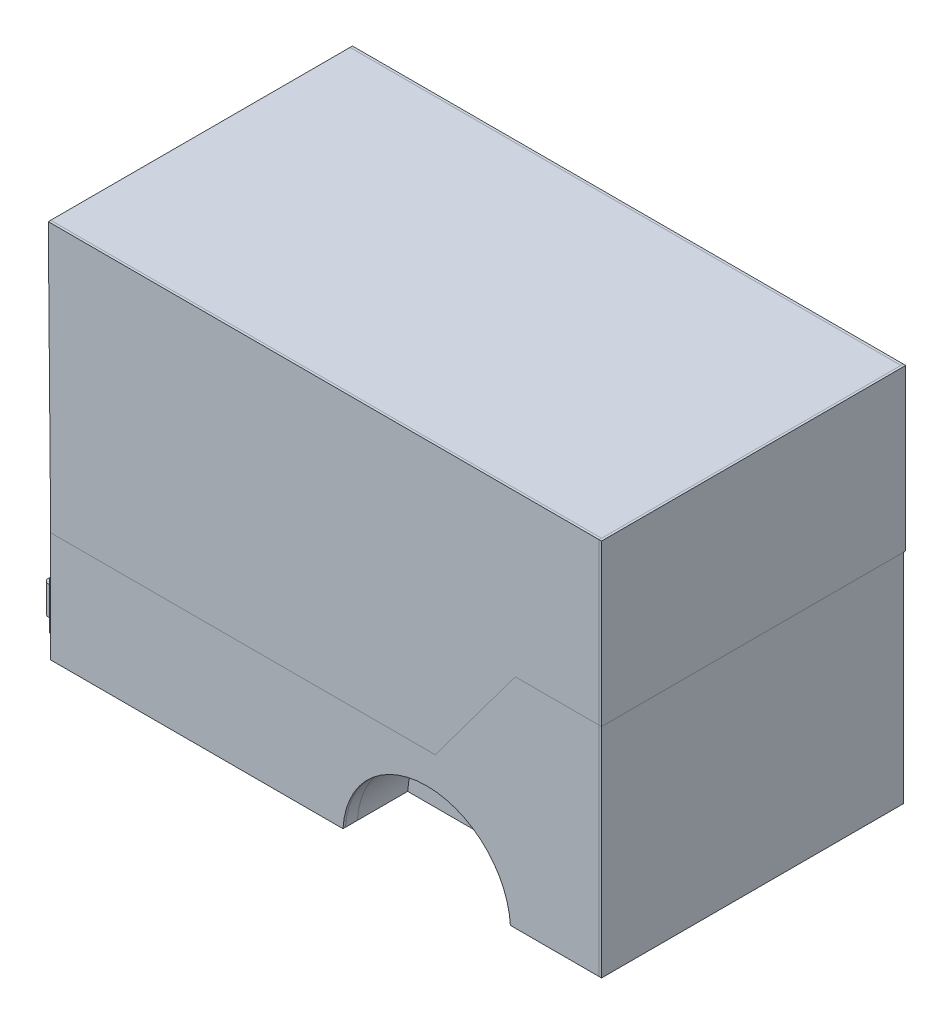
from build123d import *

# Parameters (mm, degrees)
SKETCH_1_W                = 229
SKETCH_1_H                = 125
EXTRUDE_1_DEPTH           = 88
SKETCH_4_W                = 125
SKETCH_4_H                = 88
SKETCH_4_W_2              = 123
SKETCH_4_H_2              = 86
CUT_EXTRUDE_3_DEPTH       = 1
SKETCH_5_W                = 125
SKETCH_5_H                = 88
EXTRUDE_2_DEPTH           = 1
SKETCH_11_W               = 5
SKETCH_11_H               = 20
EXTRUDE_3_DEPTH           = 2
SKETCH_12_R               = 2
EXTRUDE_4_DEPTH           = 12
SKETCH_13_R               = 35
CUT_EXTRUDE_7_DEPTH       = 26
CUT_EXTRUDE_START         = -26
SKETCH_14_R               = 35
CUT_EXTRUDE_8_DEPTH       = 26
SKETCH_16_W               = 229
SKETCH_16_H               = 125
EXTRUDE_6_DEPTH           = 70
SHELL_START               = -980.231317195
SHELL_1_OUTLINE_W         = 148
SHELL_1_OUTLINE_H         = 115
SHELL_1_DEPTH             = 113.617262665
SHELL_START_2             = -787.84857986
SHELL_1_2_OUTLINE_W       = 148
SHELL_1_2_OUTLINE_H       = 115
SHELL_1_2_DEPTH           = 31.617262665
SHELL_1_3_OUTLINE_W       = 3
SHELL_1_3_OUTLINE_H       = 63
SHELL_1_3_DEPTH           = 224
SHELL_START_3             = -981.231317195
SHELL_1_4_DEPTH           = 1
SHELL_START_4             = 7.020467364
SHELL_1_5_DEPTH           = 115
SHELL_START_5             = 33.020467364
SHELL_1_6_DEPTH           = 63
CUT_EXTRUDE_START_2       = -70
CUT_EXTRUDE_9_DEPTH       = 70
SKETCH_20_W               = 125
SKETCH_20_H               = 158
SKETCH_20_W_2             = 115
SKETCH_20_H_2             = 148
EXTRUDE_7_DEPTH           = 1
CUT_EXTRUDE_START_3       = -5
CUT_EXTRUDE_14_DEPTH      = 5
EXTRUDE_8_DEPTH           = 5
SKETCH_26_W               = 230
SKETCH_26_H               = 125
CUT_EXTRUDE_15_DEPTH      = 5
SKETCH_27_W               = 230
SKETCH_27_H               = 125
EXTRUDE_9_DEPTH           = 5
SKETCH_28_W               = 5
SKETCH_28_H               = 115
EXTRUDE_10_DEPTH          = 148
EXTRUDE_11_DEPTH          = 1
EXTRUDE_12_DEPTH          = 1
SKETCH_32_W               = 127
SKETCH_32_H               = 67.090624259
EXTRUDE_13_DEPTH          = 1
SKETCH_33_W               = 126
SKETCH_33_H               = 90.909375741
EXTRUDE_14_DEPTH          = 1
CUT_EXTRUDE_16_DEPTH      = 40
CUT_EXTRUDE_16_DEPTH_BACK = 10
SKETCH_34_W               = 225
SKETCH_34_H               = 5
SKETCH_35_W               = 220
SKETCH_35_H               = 153
EXTRUDE_16_DEPTH          = 5
SKETCH_36_W               = 5
SKETCH_36_H               = 153
EXTRUDE_17_DEPTH          = 5
CUT_EXTRUDE_17_DEPTH      = 5
SKETCH_39_W               = 115
SKETCH_39_H               = 5
CUT_EXTRUDE_18_DEPTH      = 5
SKETCH_40_W               = 5
SKETCH_40_H               = 120
EXTRUDE_19_DEPTH          = 153
SKETCH_45_W               = 78.76547467
SKETCH_45_H               = 26
EXTRUDE_21_DEPTH          = 33
CUT_EXTRUDE_20_DEPTH      = 21
SKETCH_48_R               = 34.912032086
CUT_EXTRUDE_21_DEPTH      = 21
SKETCH_51_W               = 120
SKETCH_51_H               = 50
EXTRUDE_22_DEPTH          = 35
SKETCH_53_W               = 78.76547467
SKETCH_53_H               = 33
SKETCH_53_R               = 0.014289014
CUT_EXTRUDE_22_DEPTH      = 26
SKETCH_55_W               = 15
SKETCH_55_H               = 25
EXTRUDE_23_DEPTH          = 10
FILLET_1_R                = 5
SKETCH_56_W               = 90
SKETCH_56_H               = 57
EXTRUDE_24_DEPTH          = 7
SKETCH_57_W               = 90
SKETCH_57_H               = 7
EXTRUDE_25_DEPTH          = 17
FILLET_2_R                = 5
FILLET_3_R                = 5
FILLET_4_R                = 5
SKETCH_58_W               = 120
SKETCH_58_H               = 26
EXTRUDE_26_DEPTH          = 47
SKETCH_59_W               = 78.76547467
SKETCH_59_H               = 33
CUT_EXTRUDE_24_DEPTH      = 26
SKETCH_60_W               = 120
SKETCH_60_H               = 47
EXTRUDE_27_DEPTH          = 5
SKETCH_61_W               = 30
SKETCH_61_H               = 31
EXTRUDE_28_DEPTH          = 4
SKETCH_62_R               = 9
EXTRUDE_29_DEPTH          = 1
SKETCH_63_W               = 13
SKETCH_63_H               = 4
CUT_EXTRUDE_25_DEPTH      = 1
SKETCH_64_R               = 2.5
EXTRUDE_30_DEPTH          = 1
SKETCH_65_W               = 30
SKETCH_65_H               = 45
EXTRUDE_31_DEPTH          = 31
FILLET_5_R                = 30
SKETCH_67_W               = 30
SKETCH_67_H               = 31
EXTRUDE_32_DEPTH          = 10
CUT_EXTRUDE_27_DEPTH      = 13
CUT_EXTRUDE_27_DRAFT      = -12
SKETCH_69_R               = 1.5
EXTRUDE_33_DEPTH          = 1
SKETCH_71_R               = 1.5
SKETCH_72_W               = 88
SKETCH_72_H               = 55
EXTRUDE_34_DEPTH          = 31
CUT_EXTRUDE_28_DEPTH      = 55
SKETCH_75_W               = 1
SKETCH_75_H               = 31
CUT_EXTRUDE_29_DEPTH      = 55
CUT_EXTRUDE_30_DEPTH      = 55
SKETCH_77_W               = 1
SKETCH_77_H               = 47
CUT_EXTRUDE_32_DEPTH      = 31
SKETCH_78_R               = 2.5
EXTRUDE_35_DEPTH          = 1
SKETCH_79_W               = 9
SKETCH_79_H               = 3.729617428
EXTRUDE_36_DEPTH          = 1
EXTRUDE_36_2_DEPTH        = 1
SKETCH_80_R               = 13.5
SKETCH_80_R_2             = 10.5
EXTRUDE_37_DEPTH          = 1
SKETCH_81_R               = 10.5
EXTRUDE_38_DEPTH          = 0.1
SKETCH_82_W               = 45
SKETCH_82_H               = 148
EXTRUDE_39_DEPTH          = 31
SKETCH_83_W               = 45
SKETCH_83_H               = 1
CUT_EXTRUDE_33_DEPTH      = 29
SKETCH_85_R               = 1.5
CUT_EXTRUDE_34_DEPTH      = 100
CUT_EXTRUDE_35_DEPTH      = 25
SKETCH_87_W               = 64
SKETCH_87_H               = 36
EXTRUDE_40_DEPTH          = 1
SKETCH_88_W               = 70
SKETCH_88_H               = 42
SKETCH_88_W_2             = 64
SKETCH_88_H_2             = 36
EXTRUDE_41_DEPTH          = 2
SKETCH_89_W               = 53
SKETCH_89_H               = 123
EXTRUDE_42_DEPTH          = 31
SKETCH_91_W               = 1
SKETCH_91_H               = 120
SKETCH_91_H_2             = 3
CUT_EXTRUDE_37_DEPTH      = 2
SKETCH_92_W               = 10
SKETCH_92_H               = 10
EXTRUDE_43_DEPTH          = 50
SKETCH_93_W               = 45.352646597
SKETCH_93_H               = 54.126667381
EXTRUDE_44_DEPTH          = 5


with BuildPart() as part:
    # 스케치1 → 보스-돌출1 (new body)
    with BuildSketch(Plane(origin=(0, 0, 0), x_dir=(1, 0, 0), z_dir=(0, 1, 0))):
        with Locations((-871.731317195, -64.520467364)):
            Rectangle(SKETCH_1_W, SKETCH_1_H)
    extrude(amount=EXTRUDE_1_DEPTH)

    # 스케치4 → 컷-돌출3 (cut)
    # profile 1 of 2: a face of its own
    with BuildSketch(Plane.ZY.offset(986.231317195)):
        with Locations((64.520467364, 44)):
            Rectangle(SKETCH_4_W, SKETCH_4_H)
        with Locations((64.520467364, 44)):
            Rectangle(SKETCH_4_W_2, SKETCH_4_H_2, mode=Mode.SUBTRACT)
    # profile 2 of 2: a face of its own
    with BuildSketch(Plane.ZY.offset(986.231317195)):
        with BuildLine():
            Line((6.020467364, 84), (6.020467364, 67.306026885))
            ThreePointArc((6.020467364, 67.306026885), (6.552613646, 56.95178287), (8.143444971, 46.70664722))
            Line((8.143444971, 46.70664722), (8.939528918, 42.885444272))
            ThreePointArc((8.939528918, 42.885444272), (10.498858633, 32.843182595), (11.020467364, 22.693973115))
            Line((11.020467364, 22.693973115), (11.020467364, 2))
            Line((11.020467364, 2), (118.020467364, 2))
            Line((118.020467364, 2), (118.020467364, 22.693973115))
            ThreePointArc((118.020467364, 22.693973115), (118.542076095, 32.843182595), (120.10140581, 42.885444272))
            Line((120.10140581, 42.885444272), (120.897489758, 46.70664722))
            ThreePointArc((120.897489758, 46.70664722), (122.488321083, 56.95178287), (123.020467364, 67.306026885))
            Line((123.020467364, 67.306026885), (123.020467364, 84))
            Line((123.020467364, 84), (6.020467364, 84))
        make_face()
        with BuildLine():
            Line((12.020467364, 22.693973115), (12.020467364, 3))
            Line((12.020467364, 3), (117.020467364, 3))
            Line((117.020467364, 3), (117.020467364, 22.693973115))
            ThreePointArc((117.020467364, 22.693973115), (117.547344871, 32.945699863), (119.122425391, 43.089398526))
            Line((119.122425391, 43.089398526), (119.918509338, 46.910601474))
            ThreePointArc((119.918509338, 46.910601474), (121.493589858, 57.054300137), (122.020467364, 67.306026885))
            Line((122.020467364, 67.306026885), (122.020467364, 83))
            Line((122.020467364, 83), (7.020467364, 83))
            Line((7.020467364, 83), (7.020467364, 67.306026885))
            ThreePointArc((7.020467364, 67.306026885), (7.547344871, 57.054300137), (9.122425391, 46.910601474))
            Line((9.122425391, 46.910601474), (9.918509338, 43.089398526))
            ThreePointArc((9.918509338, 43.089398526), (11.493589858, 32.945699863), (12.020467364, 22.693973115))
        make_face(mode=Mode.SUBTRACT)
    extrude(amount=-CUT_EXTRUDE_3_DEPTH, mode=Mode.SUBTRACT)

    # 스케치5 → 보스-돌출2 (add)
    with BuildSketch(Plane(origin=(-757.231317195, 0, 0), x_dir=(0, 0, -1), z_dir=(1, 0, 0))):
        with Locations((-64.520467364, 44)):
            Rectangle(SKETCH_5_W, SKETCH_5_H)
    extrude(amount=EXTRUDE_2_DEPTH)

    # 스케치13 → 컷-돌출7 (cut)
    with BuildSketch(Plane.XY.offset(127.020467364)):
        with Locations((-827.231317195, -2)):
            Circle(SKETCH_13_R)
    extrude(amount=-CUT_EXTRUDE_7_DEPTH, mode=Mode.SUBTRACT)

    # 스케치14 → 컷-돌출8 (cut)
    with BuildSketch(Plane(origin=(0, 0, 2.020467364), x_dir=(-1, 0, 0), z_dir=(0, 0, -1)).offset(CUT_EXTRUDE_START)):
        with Locations((827.231317195, -2)):
            Circle(SKETCH_14_R)
    extrude(amount=CUT_EXTRUDE_8_DEPTH, mode=Mode.SUBTRACT)

    # 스케치16 → 보스-돌출6 (add)
    with BuildSketch(Plane(origin=(0, 88, 0), x_dir=(1, 0, 0), z_dir=(0, 1, 0))):
        with Locations((-870.731317195, -64.520467364)):
            Rectangle(SKETCH_16_W, SKETCH_16_H)
    extrude(amount=EXTRUDE_6_DEPTH)

    # 쉘1: read off the stored shape, not the designer's step
    # 쉘1 outline → 쉘1 (cut)
    with BuildSketch(Plane.YZ.offset(SHELL_START)):
        with Locations((79, 64.520467364)):
            Rectangle(SHELL_1_OUTLINE_W, SHELL_1_OUTLINE_H)
    extrude(amount=SHELL_1_DEPTH, mode=Mode.SUBTRACT)

    # Shell 1 2 outline → Shell 1 2 (cut)
    with BuildSketch(Plane.YZ.offset(SHELL_START_2)):
        with Locations((79, 64.520467364)):
            Rectangle(SHELL_1_2_OUTLINE_W, SHELL_1_2_OUTLINE_H)
    extrude(amount=SHELL_1_2_DEPTH, mode=Mode.SUBTRACT)

    # Shell 1 3 outline → Shell 1 3 (cut)
    with BuildSketch(Plane.YZ.offset(SHELL_START)):
        with Locations((6.5, 64.520467364)):
            Rectangle(SHELL_1_3_OUTLINE_W, SHELL_1_3_OUTLINE_H)
    extrude(amount=SHELL_1_3_DEPTH, mode=Mode.SUBTRACT)

    # Shell 1 4 outline → Shell 1 4 (cut)
    with BuildSketch(Plane.YZ.offset(SHELL_START_3)):
        with BuildLine():
            Line((8, 96.020467364), (8, 33.020467364))
            Line((8, 33.020467364), (8, 17.020467364))
            Line((8, 17.020467364), (22.693973115, 17.020467364))
            ThreePointArc((22.693973115, 17.020467364), (33.4582862, 16.467245983), (44.109169797, 14.813411437))
            Line((44.109169797, 14.813411437), (47.930372745, 14.017327489))
            ThreePointArc((47.930372745, 14.017327489), (57.566886475, 12.521000995), (67.306026885, 12.020467364))
            Line((67.306026885, 12.020467364), (78, 12.020467364))
            Line((78, 12.020467364), (78, 117.020467364))
            Line((78, 117.020467364), (67.306026885, 117.020467364))
            ThreePointArc((67.306026885, 117.020467364), (57.566886475, 116.519933734), (47.930372745, 115.023607239))
            Line((47.930372745, 115.023607239), (44.109169797, 114.227523292))
            ThreePointArc((44.109169797, 114.227523292), (33.4582862, 112.573688746), (22.693973115, 112.020467364))
            Line((22.693973115, 112.020467364), (8, 112.020467364))
            Line((8, 112.020467364), (8, 96.020467364))
        make_face()
    extrude(amount=SHELL_1_4_DEPTH, mode=Mode.SUBTRACT)

    # Shell 1 5 outline → Shell 1 5 (cut)
    with BuildSketch(Plane.XY.offset(SHELL_START_4)):
        with BuildLine():
            Line((-787.84857986, 5), (-787.84857986, 153))
            Line((-787.84857986, 153), (-866.61405453, 153))
            Line((-866.61405453, 153), (-866.61405453, 5))
            ThreePointArc((-866.61405453, 5), (-827.231317195, 38), (-787.84857986, 5))
        make_face()
    extrude(amount=SHELL_1_5_DEPTH, mode=Mode.SUBTRACT)

    # Shell 1 6 outline → Shell 1 6 (cut)
    with BuildSketch(Plane.XY.offset(SHELL_START_5)):
        with BuildLine():
            Line((-865.961150657, 8), (-788.501483733, 8))
            ThreePointArc((-788.501483733, 8), (-827.231317195, 38), (-865.961150657, 8))
        make_face()
    extrude(amount=SHELL_1_6_DEPTH, mode=Mode.SUBTRACT)

    # 스케치18 → 컷-돌출9 (cut)
    with BuildSketch(Plane(origin=(-981.231317195, 0, 0), x_dir=(0, 0, -1), z_dir=(1, 0, 0)).offset(CUT_EXTRUDE_START_2)):
        with BuildLine():
            Line((-17.020467364, 8), (-17.020467364, 22.693973115))
            ThreePointArc((-17.020467364, 22.693973115), (-16.467245983, 33.4582862), (-14.813411437, 44.109169797))
            Line((-14.813411437, 44.109169797), (-14.017327489, 47.930372745))
            ThreePointArc((-14.017327489, 47.930372745), (-12.521000995, 57.566886475), (-12.020467364, 67.306026885))
            Line((-12.020467364, 67.306026885), (-12.020467364, 78))
            Line((-12.020467364, 78), (-117.020467364, 78))
            Line((-117.020467364, 78), (-117.020467364, 67.306026885))
            ThreePointArc((-117.020467364, 67.306026885), (-116.519933734, 57.566886475), (-115.023607239, 47.930372745))
            Line((-115.023607239, 47.930372745), (-114.227523292, 44.109169797))
            ThreePointArc((-114.227523292, 44.109169797), (-112.573688746, 33.4582862), (-112.020467364, 22.693973115))
            Line((-112.020467364, 22.693973115), (-112.020467364, 8))
            Line((-112.020467364, 8), (-17.020467364, 8))
        make_face()
    extrude(amount=CUT_EXTRUDE_9_DEPTH, mode=Mode.SUBTRACT)

    # 스케치20 → 보스-돌출7 (add)
    with BuildSketch(Plane(origin=(-756.231317195, 0, 0), x_dir=(0, 0, -1), z_dir=(1, 0, 0))):
        with Locations((-64.520467364, 79)):
            Rectangle(SKETCH_20_W, SKETCH_20_H)
        with Locations((-64.520467364, 79)):
            Rectangle(SKETCH_20_W_2, SKETCH_20_H_2, mode=Mode.SUBTRACT)
    extrude(amount=EXTRUDE_7_DEPTH)

    # 스케치24 → 컷-돌출14 (cut)
    with BuildSketch(Plane.XY.offset(127.020467364).offset(CUT_EXTRUDE_START_3)):
        with BuildLine():
            Line((-755.231317195, 153), (-980.231317195, 153))
            Line((-980.231317195, 153), (-980.231317195, 5))
            Line((-980.231317195, 5), (-866.61405453, 5))
            ThreePointArc((-866.61405453, 5), (-827.231317195, 38), (-787.84857986, 5))
            Line((-787.84857986, 5), (-755.231317195, 5))
            Line((-755.231317195, 5), (-755.231317195, 153))
        make_face()
    extrude(amount=CUT_EXTRUDE_14_DEPTH, mode=Mode.SUBTRACT)

    # 스케치26 → 컷-돌출15 (cut)
    with BuildSketch(Plane(origin=(0, 158, 0), x_dir=(1, 0, 0), z_dir=(0, 1, 0))):
        with Locations((-870.231317195, -64.520467364)):
            Rectangle(SKETCH_26_W, SKETCH_26_H)
    extrude(amount=-CUT_EXTRUDE_15_DEPTH, mode=Mode.SUBTRACT)

    # 스케치34 → 컷-돌출16 (cut, two sides: drawn at the far end of the back side and taken through both)
    with BuildSketch(Plane(origin=(0, 5, 0), x_dir=(1, 0, 0), z_dir=(0, 1, 0)).offset(-CUT_EXTRUDE_16_DEPTH_BACK)):
        with Locations((-867.731317195, -124.520467364)):
            Rectangle(SKETCH_34_W, SKETCH_34_H)
    extrude(amount=CUT_EXTRUDE_16_DEPTH + CUT_EXTRUDE_16_DEPTH_BACK, mode=Mode.SUBTRACT)

    # 스케치39 → 컷-돌출18 (cut)
    with BuildSketch(Plane(origin=(-755.231317195, 0, 0), x_dir=(0, 0, -1), z_dir=(1, 0, 0))):
        with Locations((-64.520467364, 2.5)):
            Rectangle(SKETCH_39_W, SKETCH_39_H)
    extrude(amount=-CUT_EXTRUDE_18_DEPTH, mode=Mode.SUBTRACT)

    # 스케치45 → 보스-돌출21 (add)
    with BuildSketch(Plane(origin=(0, 5, 0), x_dir=(1, 0, 0), z_dir=(0, 1, 0))):
        with Locations((-827.231317195, -20.020467364)):
            Rectangle(SKETCH_45_W, SKETCH_45_H)
        with Locations((-827.231317195, -109.020467364)):
            Rectangle(SKETCH_45_W, SKETCH_45_H)
    extrude(amount=EXTRUDE_21_DEPTH)

    # 스케치47 → 컷-돌출20 (cut)
    with BuildSketch(Plane.XY.offset(122.020467364)):
        with BuildLine():
            Line((-862.174127614, 0), (-792.288506775, 0))
            ThreePointArc((-792.288506775, 0), (-827.231317195, 33), (-862.174127614, 0))
        make_face()
    extrude(amount=-CUT_EXTRUDE_20_DEPTH, mode=Mode.SUBTRACT)

    # 스케치48 → 컷-돌출21 (cut)
    with BuildSketch(Plane(origin=(0, 0, 7.020467364), x_dir=(-1, 0, 0), z_dir=(0, 0, -1))):
        with Locations((827.252311569, -1.914574066)):
            Circle(SKETCH_48_R)
    extrude(amount=-CUT_EXTRUDE_21_DEPTH, mode=Mode.SUBTRACT)


with BuildPart() as body_2:
    # 스케치11 → 보스-돌출3 (new body)
    with BuildSketch(Plane.ZY.offset(986.231317195)):
        with Locations((122.020467364, 16)):
            Rectangle(SKETCH_11_W, SKETCH_11_H)
    extrude(amount=EXTRUDE_3_DEPTH)

    # 스케치12 → 보스-돌출4 (add)
    with BuildSketch(Plane(origin=(0, 23, 0), x_dir=(1, 0, 0), z_dir=(0, 1, 0))):
        with Locations((-989.231317195, -122.020467364)):
            Circle(SKETCH_12_R)
    extrude(amount=-EXTRUDE_4_DEPTH)


with BuildPart() as body_3:
    # 대칭 복사1: mirrored copy
    add(body_2.part.mirror(Plane.XY.offset(64.520467364)))


with BuildPart() as body_4:
    # 스케치25 → 보스-돌출8 (new body)
    with BuildSketch(Plane.XY.offset(127.020467364)):
        with BuildLine():
            Line((-980.231317195, 153), (-755.231317195, 153))
            Line((-755.231317195, 153), (-755.231317195, 5))
            Line((-755.231317195, 5), (-787.616277727, 5))
            ThreePointArc((-787.616277727, 5), (-826.999015062, 38), (-866.381752397, 5))
            Line((-866.381752397, 5), (-980.231317195, 5))
            Line((-980.231317195, 5), (-980.231317195, 153))
        make_face()
    extrude(amount=-EXTRUDE_8_DEPTH)


with BuildPart() as body_5:
    # 스케치27 → 보스-돌출9 (new body)
    with BuildSketch(Plane(origin=(0, 153, 0), x_dir=(1, 0, 0), z_dir=(0, 1, 0))):
        with Locations((-870.231317195, -64.520467364)):
            Rectangle(SKETCH_27_W, SKETCH_27_H)
    extrude(amount=EXTRUDE_9_DEPTH)


with BuildPart() as body_6:
    # 스케치28 → 보스-돌출10 (new body)
    with BuildSketch(Plane(origin=(0, 5, 0), x_dir=(1, 0, 0), z_dir=(0, 1, 0))):
        with Locations((-757.731317195, -64.520467364)):
            Rectangle(SKETCH_28_W, SKETCH_28_H)
    extrude(amount=EXTRUDE_10_DEPTH)


with BuildPart() as body_7:
    # 스케치29 → 보스-돌출11 (new body)
    with BuildSketch(Plane(origin=(0, 0, 2.020467364), x_dir=(-1, 0, 0), z_dir=(0, 0, -1))):
        with BuildLine():
            Line((984.231317195, 0), (984.231317195, 46))
            Line((984.231317195, 46), (823.655113572, 46))
            Line((823.655113572, 46), (790.231317195, 90.909375741))
            Line((790.231317195, 90.909375741), (755.231317195, 90.909375741))
            Line((755.231317195, 90.909375741), (755.231317195, 0))
            Line((755.231317195, 0), (792.288506775, 0))
            ThreePointArc((792.288506775, 0), (827.231317195, 33), (862.174127614, 0))
            Line((862.174127614, 0), (984.231317195, 0))
        make_face()
    extrude(amount=EXTRUDE_11_DEPTH)


with BuildPart() as body_8:
    # 스케치30 → 보스-돌출12 (new body)
    with BuildSketch(Plane(origin=(0, 0, 2.020467364), x_dir=(-1, 0, 0), z_dir=(0, 0, -1))):
        Polygon((755.231317195, 90.909375741), (755.231317195, 158), (985.231317195, 158), (984.231317195, 46), (823.655113572, 46), (790.231317195, 90.909375741), align=None)
    extrude(amount=EXTRUDE_12_DEPTH)


with BuildPart() as body_8_2:
    # 대칭 복사3: mirrored copy
    add(body_8.part.mirror(Plane.XY.offset(64.520467364)))


with BuildPart() as body_9:
    # Mirror 3 2: mirrored copy
    add(body_7.part.mirror(Plane.XY.offset(64.520467364)))


with BuildPart() as body_10:
    # 스케치32 → 보스-돌출13 (new body)
    with BuildSketch(Plane(origin=(-755.231317195, 0, 0), x_dir=(0, 0, -1), z_dir=(1, 0, 0))):
        with Locations((-64.520467364, 124.454687871)):
            Rectangle(SKETCH_32_W, SKETCH_32_H)
    extrude(amount=EXTRUDE_13_DEPTH)


with BuildPart() as body_11:
    # 스케치33 → 보스-돌출14 (new body)
    with BuildSketch(Plane(origin=(-755.231317195, 0, 0), x_dir=(0, 0, -1), z_dir=(1, 0, 0))):
        with Locations((-65.020467364, 45.454687871)):
            Rectangle(SKETCH_33_W, SKETCH_33_H)
    extrude(amount=EXTRUDE_14_DEPTH)


with BuildPart() as body_12:
    # 대칭 복사4: mirrored copy
    add(body_2.part.mirror(Plane.XY.offset(64.520467364)))


with BuildPart() as body_12_2:
    # 스케치35 → 보스-돌출16 (new body)
    with BuildSketch(Plane.XY.offset(122.020467364)):
        with Locations((-870.231317195, 76.5)):
            Rectangle(SKETCH_35_W, SKETCH_35_H)
    extrude(amount=EXTRUDE_16_DEPTH)

    # 스케치36 → 보스-돌출17 (add)
    with BuildSketch(Plane(origin=(-760.231317195, 0, 0), x_dir=(0, 0, -1), z_dir=(1, 0, 0))):
        with Locations((-124.520467364, 76.5)):
            Rectangle(SKETCH_36_W, SKETCH_36_H)
    extrude(amount=EXTRUDE_17_DEPTH)

    # 스케치37 → 컷-돌출17 (cut)
    with BuildSketch(Plane.XY.offset(127.020467364)):
        with BuildLine():
            Line((-862.174127614, 0), (-792.288506775, 0))
            ThreePointArc((-792.288506775, 0), (-827.231317195, 33), (-862.174127614, 0))
        make_face()
    extrude(amount=-CUT_EXTRUDE_17_DEPTH, mode=Mode.SUBTRACT)


with BuildPart() as body_12_3:
    # 스케치40 → 보스-돌출19 (new body)
    with BuildSketch(Plane.XZ):
        with Locations((-757.731317195, 67.020467364)):
            Rectangle(SKETCH_40_W, SKETCH_40_H)
    extrude(amount=-EXTRUDE_19_DEPTH)


with BuildPart() as body_13:
    # 스케치51 → 보스-돌출22 (new body)
    with BuildSketch(Plane(origin=(0, 5, 0), x_dir=(1, 0, 0), z_dir=(0, 1, 0))):
        with Locations((-820.231317195, -97.020467364)):
            Rectangle(SKETCH_51_W, SKETCH_51_H)
    extrude(amount=EXTRUDE_22_DEPTH)

    # 스케치53 → 컷-돌출22 (cut)
    with BuildSketch(Plane.XY.offset(122.020467364)):
        with Locations((-827.231317195, 21.5)):
            Rectangle(SKETCH_53_W, SKETCH_53_H)
        with Locations((-815.482459934, 30.984311243)):
            Circle(SKETCH_53_R, mode=Mode.SUBTRACT)
    extrude(amount=-CUT_EXTRUDE_22_DEPTH, mode=Mode.SUBTRACT)


with BuildPart() as body_14:
    # 스케치55 → 보스-돌출23 (new body)
    with BuildSketch(Plane(origin=(0, 40, 0), x_dir=(1, 0, 0), z_dir=(0, 1, 0))):
        with Locations((-776.731317195, -97.020467364)):
            Rectangle(SKETCH_55_W, SKETCH_55_H)
    extrude(amount=EXTRUDE_23_DEPTH)

    # 필렛1
    fillet_1_edges = [body_14.edges().sort_by_distance(p)[0] for p in [
        (-769.231317195, 50, 97.020467364),
        (-776.731317195, 50, 84.520467364),
        (-784.231317195, 50, 97.020467364),
        (-776.731317195, 50, 109.520467364),
    ]]
    fillet(fillet_1_edges, radius=FILLET_1_R)


with BuildPart() as body_15:
    # 스케치56 → 보스-돌출24 (new body)
    with BuildSketch(Plane(origin=(0, 40, 0), x_dir=(1, 0, 0), z_dir=(0, 1, 0))):
        with Locations((-835.231317195, -93.520467364)):
            Rectangle(SKETCH_56_W, SKETCH_56_H)
    extrude(amount=EXTRUDE_24_DEPTH)

    # 스케치57 → 보스-돌출25 (add)
    with BuildSketch(Plane.XZ.offset(-40)):
        with Locations((-835.231317195, 68.520467364)):
            Rectangle(SKETCH_57_W, SKETCH_57_H)
    extrude(amount=EXTRUDE_25_DEPTH)

    # 필렛2
    fillet_2_edges = [body_15.edges().sort_by_distance(p)[0] for p in [
        (-835.231317195, 47, 65.020467364),
    ]]
    fillet(fillet_2_edges, radius=FILLET_2_R)

    # 필렛3
    fillet_3_edges = [body_15.edges().sort_by_distance(p)[0] for p in [
        (-835.231317195, 23, 65.020467364),
    ]]
    fillet(fillet_3_edges, radius=FILLET_3_R)

    # 필렛4
    fillet_4_edges = [body_15.edges().sort_by_distance(p)[0] for p in [
        (-790.231317195, 47, 96.020467364),
        (-790.231317195, 35, 65.020467364),
        (-790.231317195, 45.535533906, 66.484933458),
        (-790.231317195, 23, 71.020467364),
        (-790.231317195, 24.464466094, 66.484933458),
    ]]
    fillet(fillet_4_edges, radius=FILLET_4_R)


with BuildPart() as body_16:
    # 스케치58 → 보스-돌출26 (new body)
    with BuildSketch(Plane(origin=(0, 5, 0), x_dir=(1, 0, 0), z_dir=(0, 1, 0))):
        with Locations((-820.231317195, -20.020467364)):
            Rectangle(SKETCH_58_W, SKETCH_58_H)
    extrude(amount=EXTRUDE_26_DEPTH)

    # 스케치59 → 컷-돌출24 (cut)
    with BuildSketch(Plane.XY.offset(33.020467364)):
        with Locations((-827.231317195, 21.5)):
            Rectangle(SKETCH_59_W, SKETCH_59_H)
    extrude(amount=-CUT_EXTRUDE_24_DEPTH, mode=Mode.SUBTRACT)

    # 스케치60 → 보스-돌출27 (add)
    with BuildSketch(Plane.XY.offset(33.020467364)):
        with Locations((-820.231317195, 28.5)):
            Rectangle(SKETCH_60_W, SKETCH_60_H)
    extrude(amount=EXTRUDE_27_DEPTH)


with BuildPart() as body_17:
    # 스케치61 → 보스-돌출28 (new body)
    with BuildSketch(Plane(origin=(0, 52, 0), x_dir=(1, 0, 0), z_dir=(0, 1, 0))):
        with Locations((-775.231317195, -22.520467364)):
            Rectangle(SKETCH_61_W, SKETCH_61_H)
    extrude(amount=EXTRUDE_28_DEPTH)

    # 스케치63 → 컷-돌출25 (cut)
    with BuildSketch(Plane(origin=(0, 56, 0), x_dir=(1, 0, 0), z_dir=(0, 1, 0))):
        with Locations((-780.731317195, -35.020467364)):
            Rectangle(SKETCH_63_W, SKETCH_63_H)
    extrude(amount=-CUT_EXTRUDE_25_DEPTH, mode=Mode.SUBTRACT)


with BuildPart() as body_18:
    # 스케치62 → 보스-돌출29 (new body)
    with BuildSketch(Plane(origin=(0, 56, 0), x_dir=(1, 0, 0), z_dir=(0, 1, 0))):
        with Locations(Location((-775.231317195, -18.020467364, 0), (0, 0, 270))):
            Circle(SKETCH_62_R)
    extrude(amount=EXTRUDE_29_DEPTH)


with BuildPart() as body_19:
    # 스케치64 → 보스-돌출30 (new body)
    with BuildSketch(Plane(origin=(0, 56, 0), x_dir=(1, 0, 0), z_dir=(0, 1, 0))):
        with Locations(Location((-766.369544813, -34.416744094, 0), (0, 0, 270))):
            Circle(SKETCH_64_R)
    extrude(amount=EXTRUDE_30_DEPTH)


with BuildPart() as body_20:
    # 스케치65 → 보스-돌출31 (new body)
    with BuildSketch(Plane.XY.offset(7.020467364)):
        with Locations((-775.231317195, 130.5)):
            Rectangle(SKETCH_65_W, SKETCH_65_H)
    extrude(amount=EXTRUDE_31_DEPTH)

    # 필렛5
    fillet_5_edges = [body_20.edges().sort_by_distance(p)[0] for p in [
        (-775.231317195, 153, 38.020467364),
    ]]
    fillet(fillet_5_edges, radius=FILLET_5_R)

    # 스케치67 → 보스-돌출32 (add)
    with BuildSketch(Plane.XZ.offset(-108)):
        with Locations((-775.231317195, 22.520467364)):
            Rectangle(SKETCH_67_W, SKETCH_67_H)
    extrude(amount=EXTRUDE_32_DEPTH)


with BuildPart() as cut_extrude_27_tool:
    # 스케치68 → 컷-돌출27 (with draft: the straight prism first)
    with BuildSketch(Plane(origin=(0, 52, 0), x_dir=(1, 0, 0), z_dir=(0, 1, 0))):
        with BuildLine():
            ThreePointArc((-866.429644167, -17.020467364), (-875.429644167, -26.020467364), (-866.429644167, -35.020467364))
            Line((-866.429644167, -35.020467364), (-846.429644167, -35.020467364))
            ThreePointArc((-846.429644167, -35.020467364), (-837.429644167, -26.020467364), (-846.429644167, -17.020467364))
            Line((-846.429644167, -17.020467364), (-866.429644167, -17.020467364))
        make_face()
    extrude(amount=-CUT_EXTRUDE_27_DEPTH)
    # 컷-돌출27: the draft: its side faces are tilted about the plane it starts from
    cut_extrude_27_sides = [cut_extrude_27_tool.faces().sort_by_distance(p)[0] for p in [
        (-875.429644167, 45.5, 26.020467364),
        (-856.429644167, 45.5, 35.020467364),
        (-837.429644167, 45.5, 26.020467364),
        (-856.429644167, 45.5, 17.020467364),
    ]]
    draft(cut_extrude_27_sides, Plane(origin=(0, 52, 0), x_dir=(1, 0, 0), z_dir=(0, 1, 0)), CUT_EXTRUDE_27_DRAFT)


with BuildPart() as body_16_1:
    add(body_16.part)

    # 컷-돌출27: cut by cut_extrude_27_tool
    add(cut_extrude_27_tool.part, mode=Mode.SUBTRACT)

    # 스케치77 → 컷-돌출32 (cut)
    with BuildSketch(Plane.XY.offset(38.020467364)):
        with Locations((-790.731317195, 28.5)):
            Rectangle(SKETCH_77_W, SKETCH_77_H)
    extrude(amount=-CUT_EXTRUDE_32_DEPTH, mode=Mode.SUBTRACT)


with BuildPart() as body_21:
    # 스케치69 → 보스-돌출33 (new body)
    with BuildSketch(Plane(origin=(0, 52, 0), x_dir=(1, 0, 0), z_dir=(0, 1, 0))):
        with Locations(Location((-856.429644167, -12.020467364, 0), (0, 0, 270))):
            Circle(SKETCH_69_R)
    extrude(amount=EXTRUDE_33_DEPTH)

    # 스윕2: sweep along a path in 스케치70
    with BuildLine(Plane(origin=(-856.429644167, 0, 0), x_dir=(0, 0, -1), z_dir=(1, 0, 0))) as sweep_2_path:
        Line((-12.037542877, 53), (-12.037542877, 59.791459354))
        ThreePointArc((-12.037542877, 59.791459354), (-17.020467364, 64.774383841), (-22.003391852, 59.791459354))
    # 스케치71 → 스윕2 (sweep)
    with BuildSketch(Plane(origin=(0, 53, 0), x_dir=(1, 0, 0), z_dir=(0, 1, 0))):
        with Locations((-856.429644167, -12.020467364)):
            Circle(SKETCH_71_R)
    sweep(path=sweep_2_path.line)


with BuildPart() as body_22:
    # 스케치72 → 보스-돌출34 (new body)
    with BuildSketch(Plane.XY.offset(7.020467364)):
        with Locations((-836.231317195, 125.5)):
            Rectangle(SKETCH_72_W, SKETCH_72_H)
    extrude(amount=EXTRUDE_34_DEPTH)

    # 스케치74 → 컷-돌출28 (cut)
    with BuildSketch(Plane(origin=(0, 153, 0), x_dir=(1, 0, 0), z_dir=(0, 1, 0))):
        with BuildLine():
            Line((-859.231317195, -38.020467364), (-858.231317195, -38.020467364))
            Line((-858.231317195, -38.020467364), (-858.231317195, -37.020467364))
            ThreePointArc((-858.231317195, -37.020467364), (-858.938423976, -37.313360583), (-859.231317195, -38.020467364))
        make_face()
        with BuildLine():
            Line((-836.231317195, -38.020467364), (-836.231317195, -37.020467364))
            ThreePointArc((-836.231317195, -37.020467364), (-836.938423976, -37.313360583), (-837.231317195, -38.020467364))
            Line((-837.231317195, -38.020467364), (-836.231317195, -38.020467364))
        make_face()
        with BuildLine():
            Line((-814.231317195, -38.020467364), (-814.231317195, -37.020467364))
            ThreePointArc((-814.231317195, -37.020467364), (-814.938423976, -37.313360583), (-815.231317195, -38.020467364))
            Line((-815.231317195, -38.020467364), (-814.231317195, -38.020467364))
        make_face()
        with BuildLine():
            Line((-792.231317195, -38.020467364), (-792.231317195, -37.020467364))
            ThreePointArc((-792.231317195, -37.020467364), (-792.938423976, -37.313360583), (-793.231317195, -38.020467364))
            Line((-793.231317195, -38.020467364), (-792.231317195, -38.020467364))
        make_face()
    extrude(amount=-CUT_EXTRUDE_28_DEPTH, mode=Mode.SUBTRACT)

    # 스케치75 → 컷-돌출29 (cut)
    with BuildSketch(Plane(origin=(0, 153, 0), x_dir=(1, 0, 0), z_dir=(0, 1, 0))):
        with Locations((-858.731317195, -22.520467364)):
            Rectangle(SKETCH_75_W, SKETCH_75_H)
        with Locations((-836.731317195, -22.520467364)):
            Rectangle(SKETCH_75_W, SKETCH_75_H)
        with Locations((-814.731317195, -22.520467364)):
            Rectangle(SKETCH_75_W, SKETCH_75_H)
        with Locations((-792.731317195, -22.520467364)):
            Rectangle(SKETCH_75_W, SKETCH_75_H)
    extrude(amount=-CUT_EXTRUDE_29_DEPTH, mode=Mode.SUBTRACT)


with BuildPart() as cut_extrude_29_piece_1:
    # of the separate pieces the step leaves, piece 1, a body of its own (cut_extrude_29_pieces)
    add(body_22.part.solids().sort_by_distance((-880.231317195, 153, 7.020467364))[0])


with BuildPart() as cut_extrude_29_piece_2:
    # of the separate pieces the step leaves, piece 2, a body of its own (cut_extrude_29_pieces)
    add(body_22.part.solids().sort_by_distance((-858.231317195, 153, 7.020467364))[0])


with BuildPart() as cut_extrude_29_piece_3:
    # of the separate pieces the step leaves, piece 3, a body of its own (cut_extrude_29_pieces)
    add(body_22.part.solids().sort_by_distance((-836.231317195, 153, 7.020467364))[0])


with BuildPart() as cut_extrude_29_piece_4:
    # of the separate pieces the step leaves, piece 4, a body of its own (cut_extrude_29_pieces)
    add(body_22.part.solids().sort_by_distance((-814.231317195, 153, 7.020467364))[0])


with BuildPart() as cut_extrude_30_tool:
    # 스케치76 → 컷-돌출30 (new body)
    with BuildSketch(Plane(origin=(0, 153, 0), x_dir=(1, 0, 0), z_dir=(0, 1, 0))):
        with BuildLine():
            Line((-860.731317195, -38.020467364), (-859.731317195, -38.020467364))
            ThreePointArc((-859.731317195, -38.020467364), (-860.231317195, -37.520467364), (-860.731317195, -38.020467364))
        make_face()
        with BuildLine():
            Line((-838.731317195, -38.020467364), (-837.731317195, -38.020467364))
            ThreePointArc((-837.731317195, -38.020467364), (-838.231317195, -37.520467364), (-838.731317195, -38.020467364))
        make_face()
        with BuildLine():
            Line((-816.731317195, -38.020467364), (-815.731317195, -38.020467364))
            ThreePointArc((-815.731317195, -38.020467364), (-816.231317195, -37.520467364), (-816.731317195, -38.020467364))
        make_face()
        with BuildLine():
            Line((-794.731317195, -38.020467364), (-793.731317195, -38.020467364))
            ThreePointArc((-793.731317195, -38.020467364), (-794.231317195, -37.520467364), (-794.731317195, -38.020467364))
        make_face()
    extrude(amount=-CUT_EXTRUDE_30_DEPTH)


with BuildPart() as cut_extrude_29_piece_1_1:
    add(cut_extrude_29_piece_1.part)

    # 컷-돌출30: cut by cut_extrude_30_tool
    add(cut_extrude_30_tool.part, mode=Mode.SUBTRACT)


with BuildPart() as cut_extrude_29_piece_2_1:
    add(cut_extrude_29_piece_2.part)

    # 컷-돌출30: cut by cut_extrude_30_tool
    add(cut_extrude_30_tool.part, mode=Mode.SUBTRACT)


with BuildPart() as cut_extrude_29_piece_3_1:
    add(cut_extrude_29_piece_3.part)

    # 컷-돌출30: cut by cut_extrude_30_tool
    add(cut_extrude_30_tool.part, mode=Mode.SUBTRACT)


with BuildPart() as cut_extrude_29_piece_4_1:
    add(cut_extrude_29_piece_4.part)

    # 컷-돌출30: cut by cut_extrude_30_tool
    add(cut_extrude_30_tool.part, mode=Mode.SUBTRACT)


with BuildPart() as cut_extrude_32_piece_1:
    # of the separate pieces the step leaves, piece 1, a body of its own (cut_extrude_32_pieces)
    add(body_16_1.part.solids().sort_by_distance((-880.231317195, 5, 7.020467364))[0])


with BuildPart() as cut_extrude_32_piece_2:
    # of the separate pieces the step leaves, piece 2, a body of its own (cut_extrude_32_pieces)
    add(body_16_1.part.solids().sort_by_distance((-790.231317195, 38, 7.020467364))[0])

    # 스케치81 → 보스-돌출38 (add)
    with BuildSketch(Plane.XY.offset(38.020467364)):
        with Locations((-775.231317195, 24.45370049)):
            Circle(SKETCH_81_R)
    extrude(amount=EXTRUDE_38_DEPTH)


with BuildPart() as body_27:
    # 스케치78 → 보스-돌출35 (new body)
    with BuildSketch(Plane.XY.offset(38.020467364)):
        with Locations((-775.231317195, 48)):
            Circle(SKETCH_78_R)
    extrude(amount=EXTRUDE_35_DEPTH)


with BuildPart() as body_28:
    # 스케치79 → 보스-돌출36 (new body)
    with BuildSketch(Plane.XY.offset(38.020467364)):
        with Locations((-766.731317195, 48.243317068)):
            Rectangle(SKETCH_79_W, SKETCH_79_H)
    extrude(amount=EXTRUDE_36_DEPTH)


with BuildPart() as body_29:
    # 스케치79 → Extrude 36 2 (new body)
    with BuildSketch(Plane.XY.offset(38.020467364)):
        with Locations((-783.731317195, 48.243317068)):
            Rectangle(SKETCH_79_W, SKETCH_79_H)
    extrude(amount=EXTRUDE_36_2_DEPTH)


with BuildPart() as body_30:
    # 스케치80 → 보스-돌출37 (new body)
    with BuildSketch(Plane.XY.offset(38.020467364)):
        with Locations((-775.231317195, 24.45370049)):
            Circle(SKETCH_80_R)
        with Locations((-775.231317195, 24.45370049)):
            Circle(SKETCH_80_R_2, mode=Mode.SUBTRACT)
    extrude(amount=EXTRUDE_37_DEPTH)


with BuildPart() as body_31:
    # 스케치82 → 보스-돌출39 (new body)
    with BuildSketch(Plane.XY.offset(7.020467364)):
        with Locations((-903.731317195, 79)):
            Rectangle(SKETCH_82_W, SKETCH_82_H)
    extrude(amount=EXTRUDE_39_DEPTH)

    # 스케치83 → 컷-돌출33 (cut)
    with BuildSketch(Plane.XY.offset(38.020467364)):
        with Locations((-903.731317195, 52.5)):
            Rectangle(SKETCH_83_W, SKETCH_83_H)
        with Locations((-903.731317195, 29)):
            Rectangle(SKETCH_83_W, SKETCH_83_H)
    extrude(amount=-CUT_EXTRUDE_33_DEPTH, mode=Mode.SUBTRACT)

    # 스케치85 → 컷-돌출34 (cut)
    with BuildSketch(Plane(origin=(0, 153, 0), x_dir=(1, 0, 0), z_dir=(0, 1, 0))):
        with Locations((-883.231317195, -38.020467364)):
            Circle(SKETCH_85_R)
    extrude(amount=-CUT_EXTRUDE_34_DEPTH, mode=Mode.SUBTRACT)

    # 스케치86 → 컷-돌출35 (cut)
    with BuildSketch(Plane(origin=(0, 153, 0), x_dir=(1, 0, 0), z_dir=(0, 1, 0))):
        with BuildLine():
            Line((-926.231317195, -38.020467364), (-884.731317195, -38.020467364))
            ThreePointArc((-884.731317195, -38.020467364), (-883.231317195, -36.520467364), (-881.731317195, -38.020467364))
            Line((-881.731317195, -38.020467364), (-881.231317195, -38.020467364))
            Line((-881.231317195, -38.020467364), (-881.231317195, -7.020467364))
            Line((-881.231317195, -7.020467364), (-926.231317195, -7.020467364))
            Line((-926.231317195, -7.020467364), (-926.231317195, -38.020467364))
        make_face()
    extrude(amount=-CUT_EXTRUDE_35_DEPTH, mode=Mode.SUBTRACT)


with BuildPart() as body_32:
    # 스케치87 → 보스-돌출40 (new body)
    with BuildSketch(Plane(origin=(-980.231317195, 0, 0), x_dir=(0, 0, -1), z_dir=(1, 0, 0))):
        with Locations((-86.541062755, 111.626267149)):
            Rectangle(SKETCH_87_W, SKETCH_87_H)
    extrude(amount=EXTRUDE_40_DEPTH)

    # 스케치88 → 보스-돌출41 (add)
    with BuildSketch(Plane(origin=(-980.231317195, 0, 0), x_dir=(0, 0, -1), z_dir=(1, 0, 0))):
        with Locations((-86.541062755, 111.626267149)):
            Rectangle(SKETCH_88_W, SKETCH_88_H)
        with Locations((-86.541062755, 111.626267149)):
            Rectangle(SKETCH_88_W_2, SKETCH_88_H_2, mode=Mode.SUBTRACT)
    extrude(amount=EXTRUDE_41_DEPTH)


with BuildPart() as body_33:
    # 스케치89 → 보스-돌출42 (new body)
    with BuildSketch(Plane.XY.offset(7.020467364)):
        with Locations((-953.731317195, 66.5)):
            Rectangle(SKETCH_89_W, SKETCH_89_H)
    extrude(amount=EXTRUDE_42_DEPTH)

    # 스케치91 → 컷-돌출37 (cut)
    with BuildSketch(Plane.XY.offset(38.020467364)):
        with Locations((-954.231317195, 65)):
            Rectangle(SKETCH_91_W, SKETCH_91_H)
        with Locations((-953.231317195, 65)):
            Rectangle(SKETCH_91_W, SKETCH_91_H)
        with Locations((-954.231317195, 126.5)):
            Rectangle(SKETCH_91_W, SKETCH_91_H_2)
        with Locations((-953.231317195, 126.5)):
            Rectangle(SKETCH_91_W, SKETCH_91_H_2)
    extrude(amount=-CUT_EXTRUDE_37_DEPTH, mode=Mode.SUBTRACT)


with BuildPart() as body_34:
    # 스케치92 → 보스-돌출43 (new body)
    with BuildSketch(Plane(origin=(0, 5, 0), x_dir=(1, 0, 0), z_dir=(0, 1, 0))):
        with Locations((-913.58052453, -94.541985591)):
            Rectangle(SKETCH_92_W, SKETCH_92_H)
    extrude(amount=EXTRUDE_43_DEPTH)

    # 스케치93 → 보스-돌출44 (add)
    with BuildSketch(Plane(origin=(0, 55, 0), x_dir=(1, 0, 0), z_dir=(0, 1, 0))):
        with Locations((-913.580524531, -94.541985592)):
            Rectangle(SKETCH_93_W, SKETCH_93_H)
    extrude(amount=EXTRUDE_44_DEPTH)


solid = Compound([part.part, body_2.part, body_5.part, body_7.part, body_8.part, body_8_2.part, body_9.part, body_10.part, body_11.part, body_12.part, body_12_2.part, body_12_3.part, body_13.part, body_14.part, body_15.part, body_17.part, body_18.part, body_19.part, body_20.part, body_21.part, cut_extrude_29_piece_1_1.part, cut_extrude_29_piece_2_1.part, cut_extrude_29_piece_3_1.part, cut_extrude_29_piece_4_1.part, cut_extrude_32_piece_1.part, cut_extrude_32_piece_2.part, body_27.part, body_28.part, body_29.part, body_30.part, body_31.part, body_32.part, body_33.part, body_34.part])
